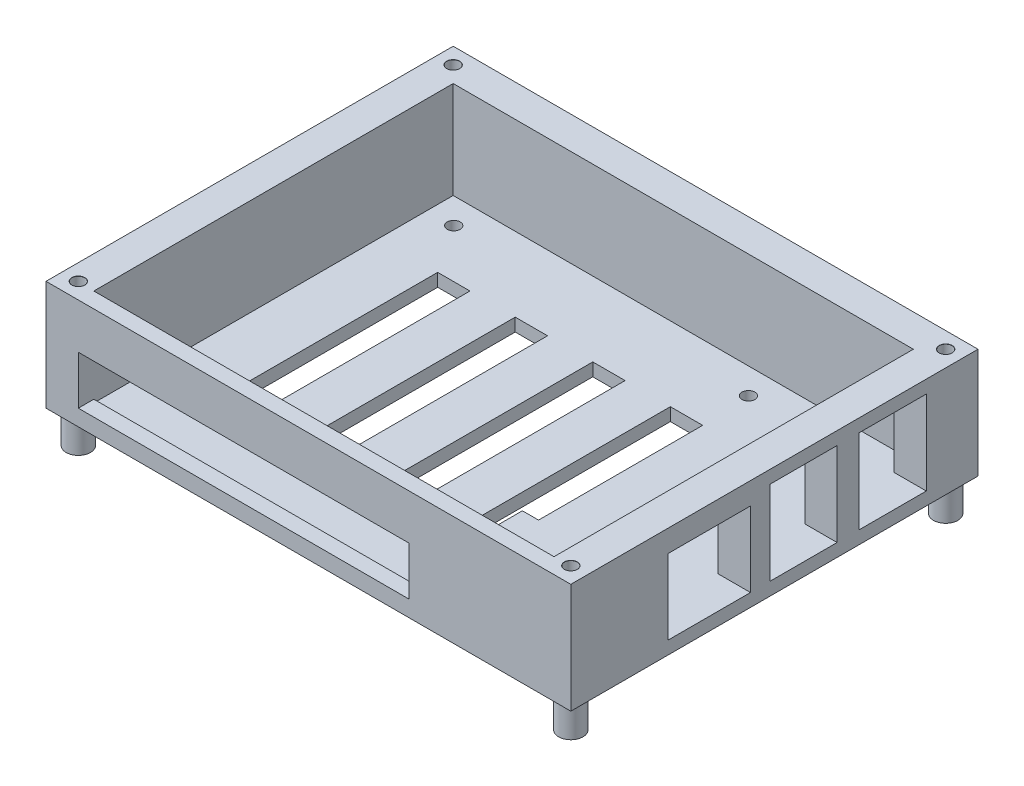
from build123d import *

# Parameters (mm, degrees)
SKETCH1_W           = 103.124
SKETCH1_H           = 80.01
SKETCH1_W_2         = 90.424
SKETCH1_H_2         = 70.612
BOSS_EXTRUDE3_DEPTH = 21.59
SKETCH1_4_W         = 90.424
SKETCH1_4_H         = 70.612
SKETCH1_4_R         = 1.27
SKETCH1_4_W_2       = 6.35
SKETCH1_4_H_2       = 38.1
BOSS_EXTRUDE4_DEPTH = 2.54
SKETCH2_W           = 16.256
SKETCH2_H           = 14.732
SKETCH2_W_2         = 13.208
SKETCH2_H_2         = 16.51
CUT_EXTRUDE1_DEPTH  = 6.35
SKETCH6_W           = 65.024
SKETCH6_H           = 9.525
CUT_EXTRUDE2_DEPTH  = 3.048
SKETCH8_R           = 2.393
SKETCH8_R_2         = 1.25
BOSS_EXTRUDE5_DEPTH = 6.35


# Read off the part's stored shape, not the designer's step: Ø2.5mm Dowel Hole1
with BuildPart() as part:
    # Sketch1 → Boss-Extrude3 (new body)
    with BuildSketch(Plane(origin=(0, 0, 0), x_dir=(1, 0, 0), z_dir=(0, 1, 0))):
        Rectangle(SKETCH1_W, SKETCH1_H)
        with Locations((0, -1.651)):
            Rectangle(SKETCH1_W_2, SKETCH1_H_2, mode=Mode.SUBTRACT)
    extrude(amount=BOSS_EXTRUDE3_DEPTH)

    # Sketch1<4> → Boss-Extrude4 (add)
    with BuildSketch(Plane(origin=(0, 0, 0), x_dir=(1, 0, 0), z_dir=(0, 1, 0))):
        with Locations((0, -1.651)):
            Rectangle(SKETCH1_4_W, SKETCH1_4_H)
        with Locations(Location((-40.024126951, -20.193, 0), (0, 0, 270))):
            Circle(SKETCH1_4_R, mode=Mode.SUBTRACT)
        with Locations((-30.48, 0)):
            Rectangle(SKETCH1_4_W_2, SKETCH1_4_H_2, mode=Mode.SUBTRACT)
        with Locations((-15.24, 0)):
            Rectangle(SKETCH1_4_W_2, SKETCH1_4_H_2, mode=Mode.SUBTRACT)
        Rectangle(SKETCH1_4_W_2, SKETCH1_4_H_2, mode=Mode.SUBTRACT)
        with BuildLine():
            ThreePointArc((18.415, -19.037561911), (18.956131264, -19.506178054), (19.157873049, -20.193))
            ThreePointArc((19.157873049, -20.193), (16.819614834, -20.879821946), (18.415, -19.037561911))
        make_face(mode=Mode.SUBTRACT)
        Polygon((12.065, -19.05), (12.065, 19.05), (18.415, 19.05), (18.415, -13.196681286), (15.24, -13.196681286), (15.24, -19.05), align=None, mode=Mode.SUBTRACT)
        with Locations((30.48, 0)):
            Rectangle(SKETCH1_4_W_2, SKETCH1_4_H_2, mode=Mode.SUBTRACT)
        with Locations(Location((-40.024126951, 28.575, 0), (0, 0, 270))):
            Circle(SKETCH1_4_R, mode=Mode.SUBTRACT)
        with Locations(Location((17.887873049, 28.575, 0), (0, 0, 270))):
            Circle(SKETCH1_4_R, mode=Mode.SUBTRACT)
    extrude(amount=BOSS_EXTRUDE4_DEPTH)

    # Sketch2 → Cut-Extrude1 (cut)
    with BuildSketch(Plane(origin=(51.562, 0, 0), x_dir=(0, 0, -1), z_dir=(1, 0, 0))):
        with Locations((-12.827, 9.906)):
            Rectangle(SKETCH2_W, SKETCH2_H)
        with Locations((5.715, 10.795)):
            Rectangle(SKETCH2_W_2, SKETCH2_H_2)
        with Locations((23.241, 10.795)):
            Rectangle(SKETCH2_W_2, SKETCH2_H_2)
    extrude(amount=-CUT_EXTRUDE1_DEPTH, mode=Mode.SUBTRACT)

    # Ø2.5mm Dowel Hole1 outline → Ø2.5mm Dowel Hole1 (revolve, cut)
    with BuildSketch(Plane(origin=(48.387, 0, -36.83), x_dir=(1, 0, 0), z_dir=(0, 0, 1))):
        Polygon((0, 0), (1.25, 0), (1.25, 21.565), (1.275, 21.59), (0, 21.59), align=None)
    revolve(axis=Axis((48.387, 0, -36.83), (0, 1, 0)), mode=Mode.SUBTRACT)

    # 2.5mm Dowel Hole1 2 outline → 2.5mm Dowel Hole1 2 (revolve, cut)
    with BuildSketch(Plane(origin=(48.387, 0, 36.83), x_dir=(1, 0, 0), z_dir=(0, 0, 1))):
        Polygon((0, 0), (1.25, 0), (1.25, 21.565), (1.275, 21.59), (0, 21.59), align=None)
    revolve(axis=Axis((48.387, 0, 36.83), (0, 1, 0)), mode=Mode.SUBTRACT)

    # 2.5mm Dowel Hole1 3 outline → 2.5mm Dowel Hole1 3 (revolve, cut)
    with BuildSketch(Plane(origin=(-48.387, 0, -36.83), x_dir=(1, 0, 0), z_dir=(0, 0, 1))):
        Polygon((0, 0), (1.25, 0), (1.25, 21.565), (1.275, 21.59), (0, 21.59), align=None)
    revolve(axis=Axis((-48.387, 0, -36.83), (0, 1, 0)), mode=Mode.SUBTRACT)

    # 2.5mm Dowel Hole1 4 outline → 2.5mm Dowel Hole1 4 (revolve, cut)
    with BuildSketch(Plane(origin=(-48.387, 0, 36.83), x_dir=(1, 0, 0), z_dir=(0, 0, 1))):
        Polygon((0, 0), (1.25, 0), (1.25, 21.565), (1.275, 21.59), (0, 21.59), align=None)
    revolve(axis=Axis((-48.387, 0, 36.83), (0, 1, 0)), mode=Mode.SUBTRACT)

    # Sketch6 → Cut-Extrude2 (cut)
    with BuildSketch(Plane.XY.offset(40.005)):
        with Locations((-12.7, 7.9375)):
            Rectangle(SKETCH6_W, SKETCH6_H)
    extrude(amount=-CUT_EXTRUDE2_DEPTH, mode=Mode.SUBTRACT)

    # Sketch8 → Boss-Extrude5 (add)
    # profile 1 of 4: a face of its own
    with BuildSketch(Plane.XZ):
        with Locations(Location((-48.387, 36.83, 0), (0, 0, 90))):
            Circle(SKETCH8_R)
        with Locations(Location((-48.387, 36.83, 0), (0, 0, 90))):
            Circle(SKETCH8_R_2, mode=Mode.SUBTRACT)
    # profile 2 of 4: a face of its own
    with BuildSketch(Plane.XZ):
        with Locations(Location((48.387, 36.83, 0), (0, 0, 270))):
            Circle(SKETCH8_R)
        with Locations(Location((48.387, 36.83, 0), (0, 0, 90))):
            Circle(SKETCH8_R_2, mode=Mode.SUBTRACT)
    # profile 3 of 4: a face of its own
    with BuildSketch(Plane.XZ):
        with Locations(Location((48.387, -36.83, 0), (0, 0, 90))):
            Circle(SKETCH8_R)
        with Locations(Location((48.387, -36.83, 0), (0, 0, 90))):
            Circle(SKETCH8_R_2, mode=Mode.SUBTRACT)
    # profile 4 of 4: a face of its own
    with BuildSketch(Plane.XZ):
        with Locations(Location((-48.387, -36.83, 0), (0, 0, 270))):
            Circle(SKETCH8_R)
        with Locations(Location((-48.387, -36.83, 0), (0, 0, 90))):
            Circle(SKETCH8_R_2, mode=Mode.SUBTRACT)
    extrude(amount=BOSS_EXTRUDE5_DEPTH)


solid = part.part
